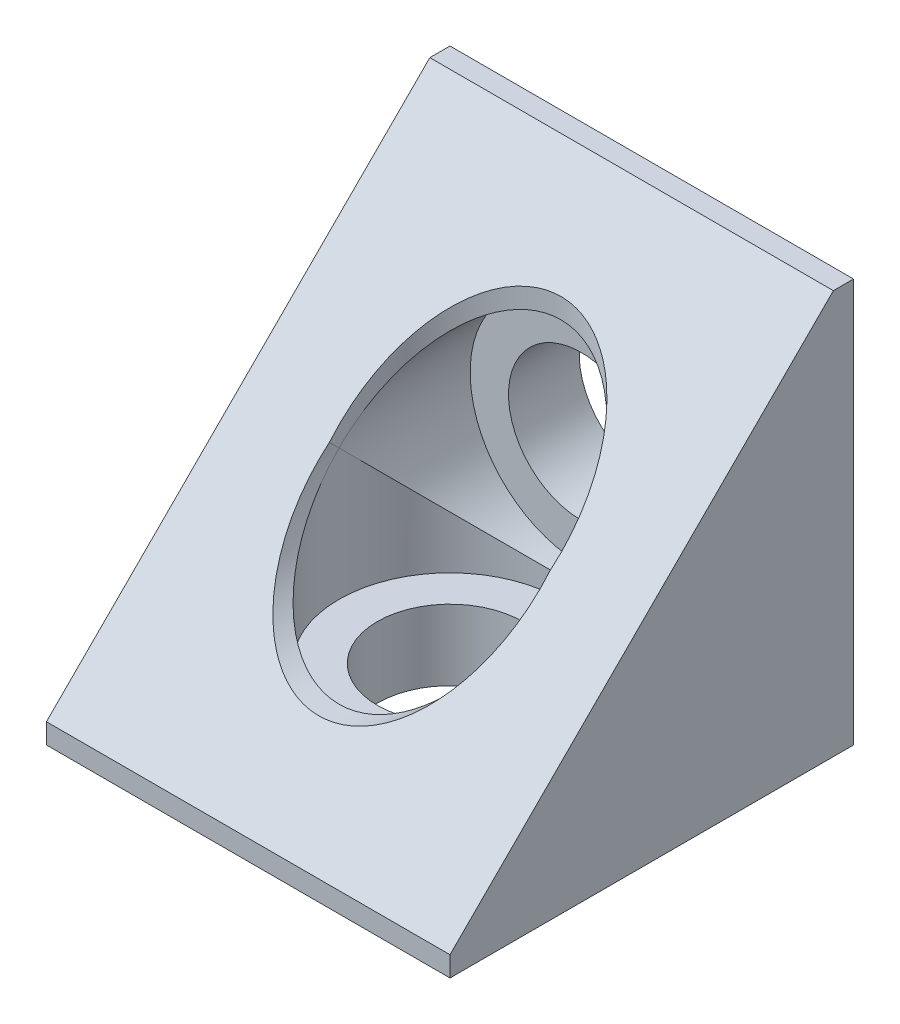
from build123d import *

# Parameters (mm, degrees)
SKETCH1_W           = 20
SKETCH1_H           = 20
SKETCH1_R           = 3.6
BOSS_EXTRUDE1_DEPTH = 10
SKETCH2_R           = 5.5
CUT_EXTRUDE1_DEPTH  = 16.5
SKETCH4_R           = 3.6
CUT_EXTRUDE2_DEPTH  = 25.494897428
SKETCH5_R           = 5.5
CUT_EXTRUDE3_DEPTH  = 16.5
CUT_EXTRUDE4_DEPTH  = 25.494897428


with BuildPart() as part:
    # Sketch1 → Boss-Extrude1 (new, symmetric)
    with BuildSketch(Plane.XY):
        Rectangle(SKETCH1_W, SKETCH1_H)
        Circle(SKETCH1_R, mode=Mode.SUBTRACT)
    extrude(amount=BOSS_EXTRUDE1_DEPTH, both=True)

    # Sketch2 → Cut-Extrude1 (cut)
    with BuildSketch(Plane.XY.offset(10)):
        Circle(SKETCH2_R)
    extrude(amount=-CUT_EXTRUDE1_DEPTH, mode=Mode.SUBTRACT)

    # Sketch4 → Cut-Extrude2 (cut, through all)
    with BuildSketch(Plane(origin=(0, 10, 0), x_dir=(1, 0, 0), z_dir=(0, 1, 0))):
        Circle(SKETCH4_R)
    extrude(amount=-CUT_EXTRUDE2_DEPTH, mode=Mode.SUBTRACT)

    # Sketch5 → Cut-Extrude3 (cut)
    with BuildSketch(Plane(origin=(0, 10, 0), x_dir=(1, 0, 0), z_dir=(0, 1, 0))):
        Circle(SKETCH5_R)
    extrude(amount=-CUT_EXTRUDE3_DEPTH, mode=Mode.SUBTRACT)

    # Sketch6 → Cut-Extrude4 (cut, through all)
    with BuildSketch(Plane(origin=(10, 0, 0), x_dir=(0, 0, -1), z_dir=(1, 0, 0))):
        Polygon((-10, -9), (9, 10), (-10, 10), align=None)
    extrude(amount=-CUT_EXTRUDE4_DEPTH, mode=Mode.SUBTRACT)


solid = part.part
